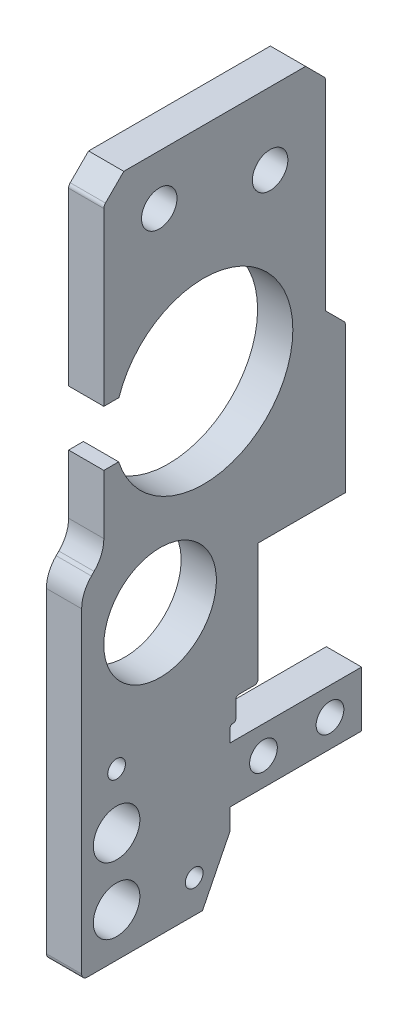
from build123d import *

# Parameters (mm, degrees)
SKETCH1_R             = 5.075
SKETCH1_R_2           = 1.6
SKETCH1_R_3           = 1.25
SKETCH1_R_4           = 2.1
SKETCH1_R_5           = 0.8
BOSS_EXTRUDE1_DEPTH   = 3.18
CHAMFER1_SIZE         = 2.5
CHAMFER1_SIZE2        = 4.998920521
FILLET2_R             = 3
CHAMFER2_SIZE         = 1.8
FILLET4_R             = 0.5
FILLET7_R             = 0.2
M3X0_5_TAPPED_HOLE1_D = 2.5
M2_TAPPED_HOLE1_D     = 1.6
FILLET8_R             = 0.3
CUT_EXTRUDE5_DEPTH    = 4


with BuildPart() as part:
    # Sketch1 → Boss-Extrude1 (new body)
    with BuildSketch(Plane(origin=(0, 0, 0), x_dir=(0, 0, -1), z_dir=(1, 0, 0))):
        Polygon((0, 0), (0, 30.275), (2, 32.275), (2, 61.31), (22, 61.31), (22, 41.31), (23.8, 41.31), (23.8, 26.21), (15.9, 26.21), (15.9, 15.26), (13.9, 15.26), (13.9, 13.26), (13.4, 13.26), (13.4, 11.86), (25.25, 11.86), (25.25, 6.86), (13.4, 6.86), (13.4, 0), align=None)
        with Locations(Location((7.075, 25.2, 0), (0, 0, 180))):
            Circle(SKETCH1_R, mode=Mode.SUBTRACT)
        with Locations(Location((7, 56.81, 0), (0, 0, 180))):
            Circle(SKETCH1_R_2, mode=Mode.SUBTRACT)
        with Locations(Location((17, 54.81, 0), (0, 0, 180))):
            Circle(SKETCH1_R_2, mode=Mode.SUBTRACT)
        with Locations(Location((22.4, 9.36, 0), (0, 0, 180))):
            Circle(SKETCH1_R_3, mode=Mode.SUBTRACT)
        with Locations(Location((16.4, 9.36, 0), (0, 0, 180))):
            Circle(SKETCH1_R_3, mode=Mode.SUBTRACT)
        with Locations(Location((3.15, 3.95, 0), (0, 0, 180))):
            Circle(SKETCH1_R_4, mode=Mode.SUBTRACT)
        with Locations(Location((3.15, 9.95, 0), (0, 0, 180))):
            Circle(SKETCH1_R_4, mode=Mode.SUBTRACT)
        with Locations(Location((10.15, 2.95, 0), (0, 0, 180))):
            Circle(SKETCH1_R_5, mode=Mode.SUBTRACT)
        with Locations(Location((3.15, 14.95, 0), (0, 0, 180))):
            Circle(SKETCH1_R_5, mode=Mode.SUBTRACT)
    extrude(amount=BOSS_EXTRUDE1_DEPTH)

    # Chamfer1
    chamfer1_edges = [part.edges().sort_by_distance(p)[0] for p in [
        (1.59, 0, -13.4),
    ]]
    chamfer1_side = [part.faces().sort_by_distance(p)[0] for p in [
        (1.59, 0, -6.7),
    ]]
    chamfer(chamfer1_edges, length=CHAMFER1_SIZE, length2=CHAMFER1_SIZE2, reference=chamfer1_side[0])

    # Fillet2
    fillet2_edges = [part.edges().sort_by_distance(p)[0] for p in [
        (1.59, 30.275, 0),
        (1.59, 32.275, -2),
    ]]
    fillet(fillet2_edges, radius=FILLET2_R)

    # Chamfer2
    chamfer2_edges = [part.edges().sort_by_distance(p)[0] for p in [
        (1.59, 61.31, -22),
        (1.59, 61.31, -2),
        (1.59, 41.31, -23.8),
    ]]
    chamfer(chamfer2_edges, length=CHAMFER2_SIZE - 0.0001)  # a hair under: the kernel refuses the full size

    # Fillet4
    fillet4_edges = [part.edges().sort_by_distance(p)[0] for p in [
        (1.59, 39.5101, -23.8),
        (1.59, 59.5101, -22),
        (1.59, 59.5101, -2),
        (1.59, 0, 0),
        (1.59, 4.998920521, -13.4),
    ]]
    fillet(fillet4_edges, radius=FILLET4_R)

    # Fillet7
    fillet7_edges = [part.edges().sort_by_distance(p)[0] for p in [
        (1.59, 13.26, -13.9),
        (1.59, 13.26, -13.4),
    ]]
    fillet(fillet7_edges, radius=FILLET7_R)

    # M3x0.5 Tapped Hole1 (through all)
    with Locations(Plane(origin=(3.18, 0, 0), x_dir=(0, 0, -1), z_dir=(1, 0, 0))):
        with Locations((16.4, 9.36), (22.4, 9.36)):
            Hole(M3X0_5_TAPPED_HOLE1_D / 2)

    # M2 Tapped Hole1 (through all)
    with Locations(Plane(origin=(0, 14.95, -3.15), x_dir=(0, 0, -1), z_dir=(-1, 0, 0))):
        with Locations((0, 0), (7, 12)):
            Hole(M2_TAPPED_HOLE1_D / 2)

    # Fillet8
    fillet8_edges = [part.edges().sort_by_distance(p)[0] for p in [
        (1.59, 15.26, -15.9),
        (1.59, 15.26, -13.9),
    ]]
    fillet(fillet8_edges, radius=FILLET8_R)

    # Sketch13 → Cut-Extrude5 (cut)
    with BuildSketch(Plane(origin=(3.18, 0, 0), x_dir=(0, 0, -1), z_dir=(1, 0, 0))):
        with BuildLine():
            Line((2, 43.846624835), (2, 38.846624835))
            Line((2, 38.846624835), (3.336170487, 38.846624835))
            ThreePointArc((3.336170487, 38.846624835), (19.049907791, 41.271469968), (3.360102459, 43.846624835))
            Line((3.360102459, 43.846624835), (2, 43.846624835))
        make_face()
    extrude(amount=-CUT_EXTRUDE5_DEPTH, mode=Mode.SUBTRACT)


solid = part.part
